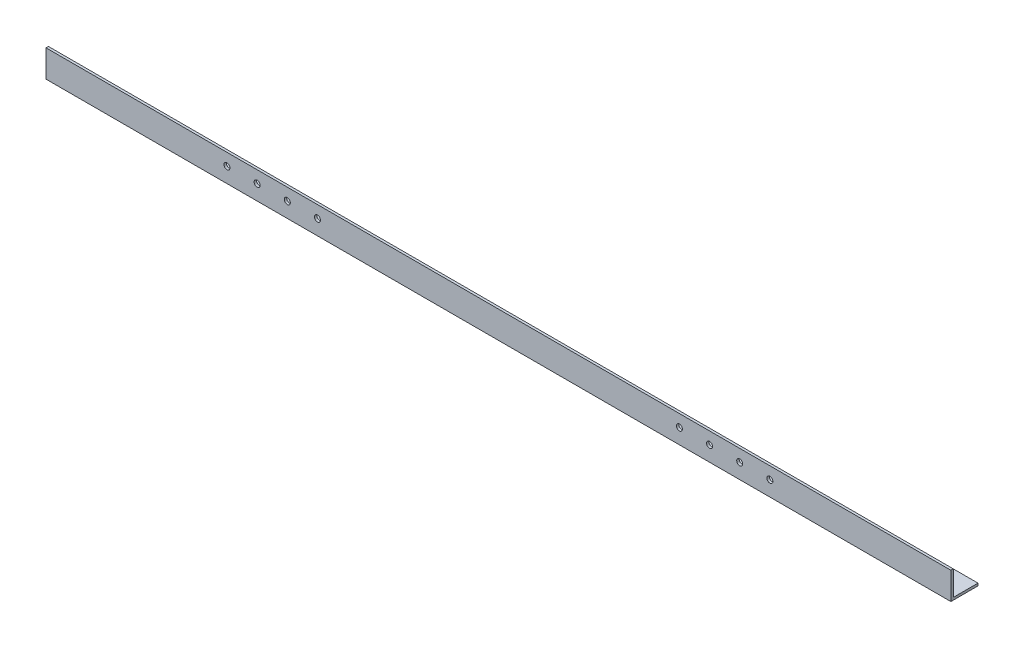
from build123d import *

# Parameters (mm, degrees)
EXTRUDE_1_DEPTH     = 1500
SKETCH_2_R          = 5
CUT_EXTRUDE_1_DEPTH = 1502.349393046


with BuildPart() as part:
    # Эскиз1 → Вытянуть-Тонкостенный1 (new body)
    with BuildSketch(Plane(origin=(0, 0, 0), x_dir=(0, 0, -1), z_dir=(1, 0, 0))):
        Polygon((45, 0), (0, 0), (0, 45), (4, 45), (4, 4), (45, 4), align=None)
    extrude(amount=EXTRUDE_1_DEPTH)

    # Эскиз2 → Вырез-Вытянуть1 (cut, through all)
    with BuildSketch(Plane.XY):
        with Locations((300, 25)):
            Circle(SKETCH_2_R)
        with Locations((350, 25)):
            Circle(SKETCH_2_R)
        with Locations((400, 25)):
            Circle(SKETCH_2_R)
        with Locations((450, 25)):
            Circle(SKETCH_2_R)
        with Locations((1050, 25)):
            Circle(SKETCH_2_R)
        with Locations((1100, 25)):
            Circle(SKETCH_2_R)
        with Locations((1150, 25)):
            Circle(SKETCH_2_R)
        with Locations((1200, 25)):
            Circle(SKETCH_2_R)
    extrude(amount=-CUT_EXTRUDE_1_DEPTH, mode=Mode.SUBTRACT)


solid = part.part
